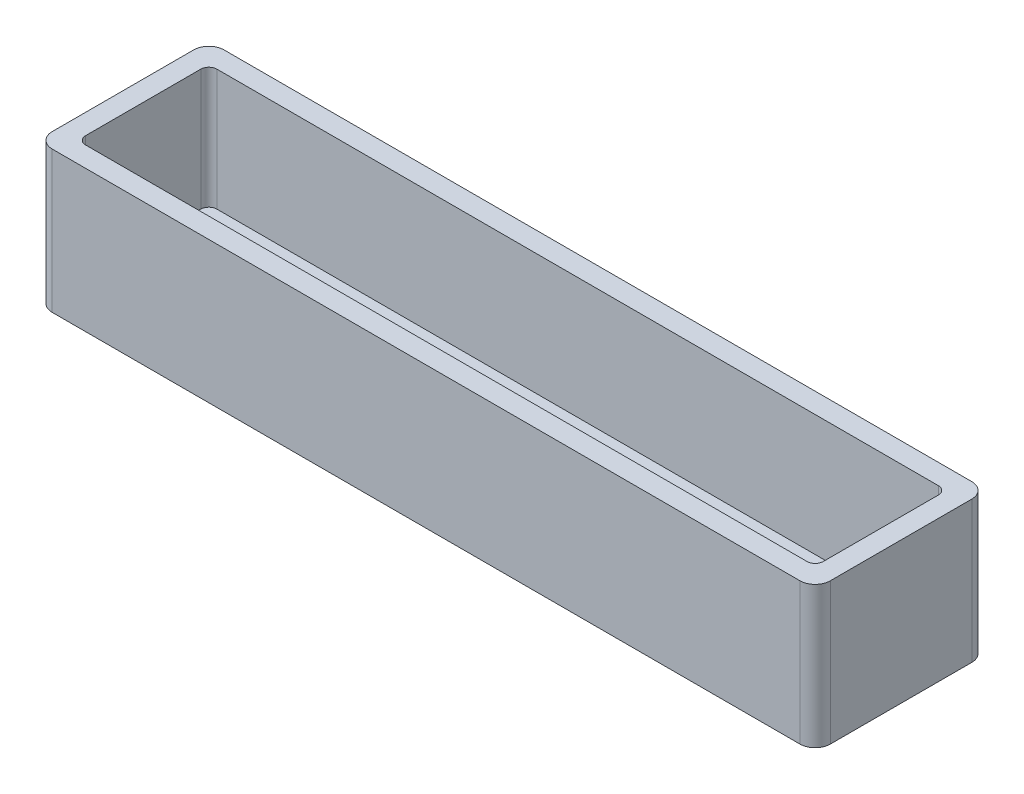
from build123d import *

# Parameters (mm, degrees)
SKETCH1_W           = 244.475
SKETCH1_H           = 53.975
SKETCH1_W_2         = 231.775
SKETCH1_H_2         = 41.275
BOSS_EXTRUDE1_DEPTH = 38.1
SKETCH2_W           = 244.475
SKETCH2_H           = 53.975
SKETCH2_R           = 12.065
BOSS_EXTRUDE2_DEPTH = 6.35
FILLET1_R           = 2.54
FILLET2_R           = 4.7625


with BuildPart() as part:
    # Sketch1 → Boss-Extrude1 (new body)
    with BuildSketch(Plane(origin=(0, 0, 0), x_dir=(1, 0, 0), z_dir=(0, 1, 0))):
        Rectangle(SKETCH1_W, SKETCH1_H)
        Rectangle(SKETCH1_W_2, SKETCH1_H_2, mode=Mode.SUBTRACT)
    extrude(amount=BOSS_EXTRUDE1_DEPTH)

    # Sketch2 → Boss-Extrude2 (add)
    with BuildSketch(Plane.XZ):
        Rectangle(SKETCH2_W, SKETCH2_H)
        with Locations((88.9, 0)):
            Circle(SKETCH2_R, mode=Mode.SUBTRACT)
        with BuildLine():
            ThreePointArc((104.4, -2.1), (106.5, 0), (104.4, 2.1))
            ThreePointArc((104.4, 2.1), (102.3, 0), (104.4, -2.1))
        make_face(mode=Mode.SUBTRACT)
        with BuildLine():
            ThreePointArc((73.4, -2.1), (75.5, 0), (73.4, 2.1))
            ThreePointArc((73.4, 2.1), (71.3, 0), (73.4, -2.1))
        make_face(mode=Mode.SUBTRACT)
    extrude(amount=BOSS_EXTRUDE2_DEPTH)

    # Fillet1
    fillet1_edges = [part.edges().sort_by_distance(p)[0] for p in [
        (115.8875, 19.05, -20.6375),
        (115.8875, 19.05, 20.6375),
        (-115.8875, 19.05, 20.6375),
        (-115.8875, 19.05, -20.6375),
    ]]
    fillet(fillet1_edges, radius=FILLET1_R)

    # Fillet2
    fillet2_edges = [part.edges().sort_by_distance(p)[0] for p in [
        (-122.2375, 15.875, -26.9875),
        (122.2375, 15.875, -26.9875),
        (122.2375, 15.875, 26.9875),
        (-122.2375, 15.875, 26.9875),
    ]]
    fillet(fillet2_edges, radius=FILLET2_R)


solid = part.part
